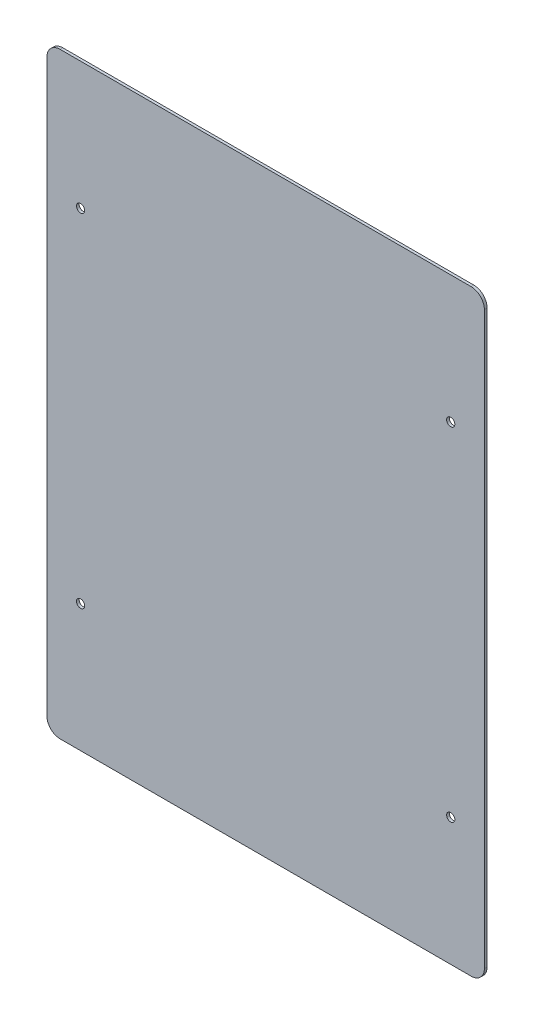
from build123d import *

# Parameters (mm, degrees)
SKETCH2_W               = 330
SKETCH2_H               = 450.48
BOSS_EXTRUDE1_DEPTH     = 2.032
CUT_EXTRUDE5_DEPTH      = 280.217095866
CUT_EXTRUDE5_DEPTH_BACK = 280.217095866
SKETCH7_R               = 3.1
FILLET4_R               = 10


with BuildPart() as part:
    # Sketch2 → Boss-Extrude1 (new body)
    with BuildSketch(Plane.XY):
        Rectangle(SKETCH2_W, SKETCH2_H)
    extrude(amount=BOSS_EXTRUDE1_DEPTH)

    # Sketch7 → Cut-Extrude5 (cut, two sides: drawn at the far end of the back side and taken through both)
    with BuildSketch(Plane.XY.offset(2.032).offset(-CUT_EXTRUDE5_DEPTH_BACK)):
        with Locations((-139.599996944, -129.109949366)):
            Circle(SKETCH7_R)
        with Locations((-139.599996944, 129.110047578)):
            Circle(SKETCH7_R)
        with Locations((139.600003056, 129.110047578)):
            Circle(SKETCH7_R)
        with Locations((139.600003056, -129.109949366)):
            Circle(SKETCH7_R)
    extrude(amount=CUT_EXTRUDE5_DEPTH + CUT_EXTRUDE5_DEPTH_BACK, mode=Mode.SUBTRACT)

    # Fillet4
    fillet4_edges = [part.edges().sort_by_distance(p)[0] for p in [
        (-165, -225.24, 1.016),
        (165, -225.24, 1.016),
        (-165, 225.24, 1.016),
        (165, 225.24, 1.016),
    ]]
    fillet(fillet4_edges, radius=FILLET4_R)


solid = part.part
